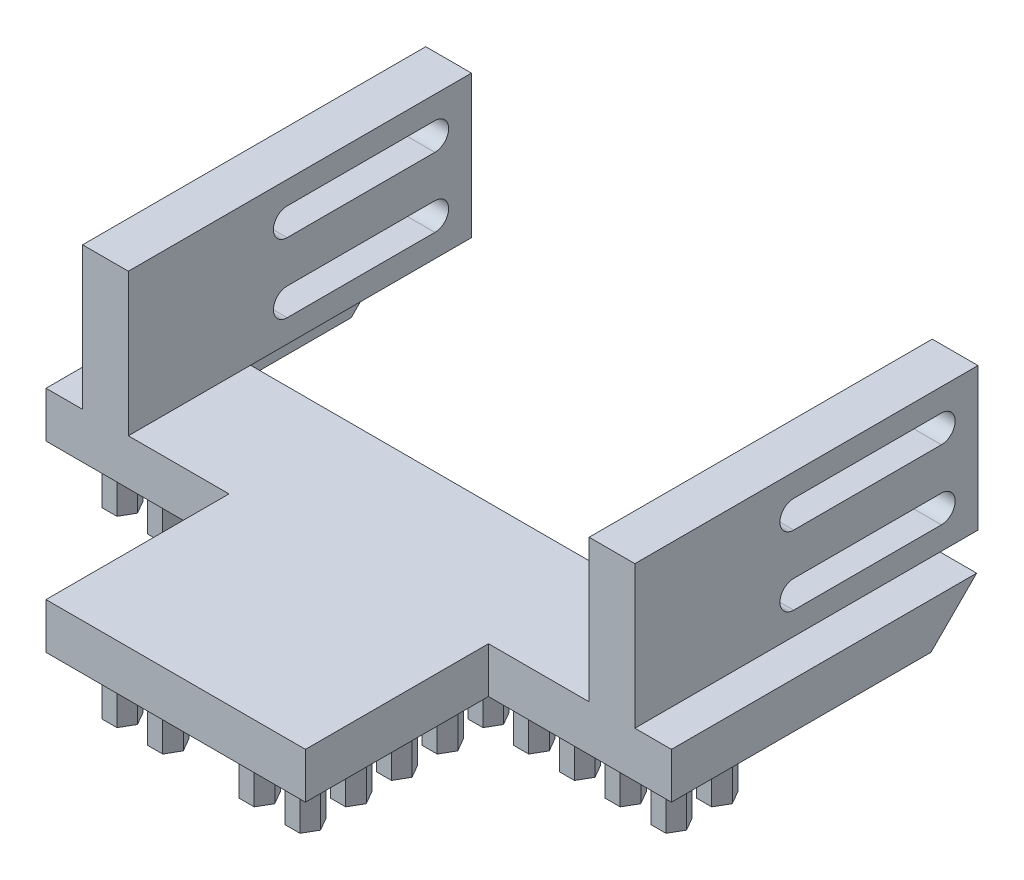
from build123d import *

# Parameters (mm, degrees)
BOSS_EXTRUDE1_DEPTH = 10
BOSS_EXTRUDE2_DEPTH = 12
BOSS_EXTRUDE3_START = -8
SKETCH4_W           = 75
SKETCH4_H           = 31.155444566
BOSS_EXTRUDE3_DEPTH = 10
CHAMFER1_SIZE       = 10


with BuildPart() as part:
    # Sketch3 → Boss-Extrude1 (new body)
    with BuildSketch(Plane(origin=(0, 0, 0), x_dir=(1, 0, 0), z_dir=(0, 1, 0))):
        Polygon((68.354551733, 48.354551733), (68.354551733, -18.354551733), (28.354551733, -18.354551733), (28.354551733, -58.354551733), (-28.354551733, -58.354551733), (-28.354551733, -18.354551733), (-68.354551733, -18.354551733), (-68.354551733, 48.354551733), (-58.354551733, 48.354551733), (-58.354551733, 8.354551733), (58.354551733, 8.354551733), (58.354551733, 48.354551733), align=None)
    extrude(amount=BOSS_EXTRUDE1_DEPTH)

    # Sketch2 → Boss-Extrude2 (add)
    with BuildSketch(Plane(origin=(0, 0, 0), x_dir=(1, 0, 0), z_dir=(0, 1, 0))):
        Polygon((-53.290896534, -10), (-51.645448267, -12.85), (-48.354551733, -12.85), (-46.709103466, -10), (-48.354551733, -7.15), (-51.645448267, -7.15), align=None)
        Polygon((-63.290896534, 0), (-61.645448267, -2.85), (-58.354551733, -2.85), (-56.709103466, 0), (-58.354551733, 2.85), (-61.645448267, 2.85), align=None)
        Polygon((-63.290896534, -10), (-61.645448267, -12.85), (-58.354551733, -12.85), (-56.709103466, -10), (-58.354551733, -7.15), (-61.645448267, -7.15), align=None)
        Polygon((-53.290896534, 0), (-51.645448267, -2.85), (-48.354551733, -2.85), (-46.709103466, 0), (-48.354551733, 2.85), (-51.645448267, 2.85), align=None)
        Polygon((-43.290896534, -10), (-41.645448267, -12.85), (-38.354551733, -12.85), (-36.709103466, -10), (-38.354551733, -7.15), (-41.645448267, -7.15), align=None)
        Polygon((-43.290896534, 0), (-41.645448267, -2.85), (-38.354551733, -2.85), (-36.709103466, 0), (-38.354551733, 2.85), (-41.645448267, 2.85), align=None)
        Polygon((-33.290896534, -10), (-31.645448267, -12.85), (-28.354551733, -12.85), (-26.709103466, -10), (-28.354551733, -7.15), (-31.645448267, -7.15), align=None)
        Polygon((-33.290896534, 0), (-31.645448267, -2.85), (-28.354551733, -2.85), (-26.709103466, 0), (-28.354551733, 2.85), (-31.645448267, 2.85), align=None)
        Polygon((-23.290896534, -10), (-21.645448267, -12.85), (-18.354551733, -12.85), (-16.709103466, -10), (-18.354551733, -7.15), (-21.645448267, -7.15), align=None)
        Polygon((-23.290896534, 0), (-21.645448267, -2.85), (-18.354551733, -2.85), (-16.709103466, 0), (-18.354551733, 2.85), (-21.645448267, 2.85), align=None)
        Polygon((-13.290896534, -10), (-11.645448267, -12.85), (-8.354551733, -12.85), (-6.709103466, -10), (-8.354551733, -7.15), (-11.645448267, -7.15), align=None)
        Polygon((-13.290896534, 0), (-11.645448267, -2.85), (-8.354551733, -2.85), (-6.709103466, 0), (-8.354551733, 2.85), (-11.645448267, 2.85), align=None)
        Polygon((-23.290896534, -20), (-21.645448267, -22.85), (-18.354551733, -22.85), (-16.709103466, -20), (-18.354551733, -17.15), (-21.645448267, -17.15), align=None)
        Polygon((-13.290896534, -20), (-11.645448267, -22.85), (-8.354551733, -22.85), (-6.709103466, -20), (-8.354551733, -17.15), (-11.645448267, -17.15), align=None)
        Polygon((-23.290896534, -30), (-21.645448267, -32.85), (-18.354551733, -32.85), (-16.709103466, -30), (-18.354551733, -27.15), (-21.645448267, -27.15), align=None)
        Polygon((-13.290896534, -30), (-11.645448267, -32.85), (-8.354551733, -32.85), (-6.709103466, -30), (-8.354551733, -27.15), (-11.645448267, -27.15), align=None)
        Polygon((-23.290896534, -40), (-21.645448267, -42.85), (-18.354551733, -42.85), (-16.709103466, -40), (-18.354551733, -37.15), (-21.645448267, -37.15), align=None)
        Polygon((-13.290896534, -40), (-11.645448267, -42.85), (-8.354551733, -42.85), (-6.709103466, -40), (-8.354551733, -37.15), (-11.645448267, -37.15), align=None)
        Polygon((-23.290896534, -50), (-21.645448267, -52.85), (-18.354551733, -52.85), (-16.709103466, -50), (-18.354551733, -47.15), (-21.645448267, -47.15), align=None)
        Polygon((-13.290896534, -50), (-11.645448267, -52.85), (-8.354551733, -52.85), (-6.709103466, -50), (-8.354551733, -47.15), (-11.645448267, -47.15), align=None)
        Polygon((11.645448267, -47.15), (13.290896534, -50), (11.645448267, -52.85), (8.354551733, -52.85), (6.709103466, -50), (8.354551733, -47.15), align=None)
        Polygon((21.645448267, -47.15), (23.290896534, -50), (21.645448267, -52.85), (18.354551733, -52.85), (16.709103466, -50), (18.354551733, -47.15), align=None)
        Polygon((11.645448267, -37.15), (13.290896534, -40), (11.645448267, -42.85), (8.354551733, -42.85), (6.709103466, -40), (8.354551733, -37.15), align=None)
        Polygon((21.645448267, -37.15), (23.290896534, -40), (21.645448267, -42.85), (18.354551733, -42.85), (16.709103466, -40), (18.354551733, -37.15), align=None)
        Polygon((11.645448267, -27.15), (13.290896534, -30), (11.645448267, -32.85), (8.354551733, -32.85), (6.709103466, -30), (8.354551733, -27.15), align=None)
        Polygon((21.645448267, -27.15), (23.290896534, -30), (21.645448267, -32.85), (18.354551733, -32.85), (16.709103466, -30), (18.354551733, -27.15), align=None)
        Polygon((11.645448267, -17.15), (13.290896534, -20), (11.645448267, -22.85), (8.354551733, -22.85), (6.709103466, -20), (8.354551733, -17.15), align=None)
        Polygon((21.645448267, -17.15), (23.290896534, -20), (21.645448267, -22.85), (18.354551733, -22.85), (16.709103466, -20), (18.354551733, -17.15), align=None)
        Polygon((11.645448267, 2.85), (13.290896534, 0), (11.645448267, -2.85), (8.354551733, -2.85), (6.709103466, 0), (8.354551733, 2.85), align=None)
        Polygon((11.645448267, -7.15), (13.290896534, -10), (11.645448267, -12.85), (8.354551733, -12.85), (6.709103466, -10), (8.354551733, -7.15), align=None)
        Polygon((21.645448267, 2.85), (23.290896534, 0), (21.645448267, -2.85), (18.354551733, -2.85), (16.709103466, 0), (18.354551733, 2.85), align=None)
        Polygon((21.645448267, -7.15), (23.290896534, -10), (21.645448267, -12.85), (18.354551733, -12.85), (16.709103466, -10), (18.354551733, -7.15), align=None)
        Polygon((31.645448267, 2.85), (33.290896534, 0), (31.645448267, -2.85), (28.354551733, -2.85), (26.709103466, 0), (28.354551733, 2.85), align=None)
        Polygon((31.645448267, -7.15), (33.290896534, -10), (31.645448267, -12.85), (28.354551733, -12.85), (26.709103466, -10), (28.354551733, -7.15), align=None)
        Polygon((41.645448267, 2.85), (43.290896534, 0), (41.645448267, -2.85), (38.354551733, -2.85), (36.709103466, 0), (38.354551733, 2.85), align=None)
        Polygon((41.645448267, -7.15), (43.290896534, -10), (41.645448267, -12.85), (38.354551733, -12.85), (36.709103466, -10), (38.354551733, -7.15), align=None)
        Polygon((51.645448267, 2.85), (53.290896534, 0), (51.645448267, -2.85), (48.354551733, -2.85), (46.709103466, 0), (48.354551733, 2.85), align=None)
        Polygon((51.645448267, -7.15), (53.290896534, -10), (51.645448267, -12.85), (48.354551733, -12.85), (46.709103466, -10), (48.354551733, -7.15), align=None)
        Polygon((61.645448267, -7.15), (63.290896534, -10), (61.645448267, -12.85), (58.354551733, -12.85), (56.709103466, -10), (58.354551733, -7.15), align=None)
        Polygon((61.645448267, 2.85), (63.290896534, 0), (61.645448267, -2.85), (58.354551733, -2.85), (56.709103466, 0), (58.354551733, 2.85), align=None)
    extrude(amount=-BOSS_EXTRUDE2_DEPTH)

    # Sketch4 → Boss-Extrude3 (add)
    with BuildSketch(Plane.ZY.offset(58.354551733).offset(BOSS_EXTRUDE3_START)):
        with Locations((-19.145448267, 25.577722283)):
            Rectangle(SKETCH4_W, SKETCH4_H)
        with BuildLine():
            Line((-48.645448267, 21), (-16.354551733, 21))
            ThreePointArc((-16.354551733, 21), (-13.354551733, 18), (-16.354551733, 15))
            Line((-16.354551733, 15), (-48.645448267, 15))
            ThreePointArc((-48.645448267, 15), (-51.645448267, 18), (-48.645448267, 21))
        make_face(mode=Mode.SUBTRACT)
        with BuildLine():
            Line((-48.645448267, 36.155444566), (-16.354551733, 36.155444566))
            ThreePointArc((-16.354551733, 36.155444566), (-13.354551733, 33.155444566), (-16.354551733, 30.155444566))
            Line((-16.354551733, 30.155444566), (-48.645448267, 30.155444566))
            ThreePointArc((-48.645448267, 30.155444566), (-51.645448267, 33.155444566), (-48.645448267, 36.155444566))
        make_face(mode=Mode.SUBTRACT)
    boss_extrude3 = extrude(amount=BOSS_EXTRUDE3_DEPTH)

    # Mirror1: Boss-Extrude3 across plane
    add(boss_extrude3.mirror(Plane(origin=(0, 0, 0), x_dir=(0, 0, 1), z_dir=(1, 0, 0))))

    # Chamfer1
    chamfer1_edges = [part.edges().sort_by_distance(p)[0] for p in [
        (63.354551733, 0, -48.354551733),
        (-63.354551733, 0, -48.354551733),
    ]]
    chamfer(chamfer1_edges, length=CHAMFER1_SIZE - 0.0001)  # a hair under: the kernel refuses the full size


solid = part.part
